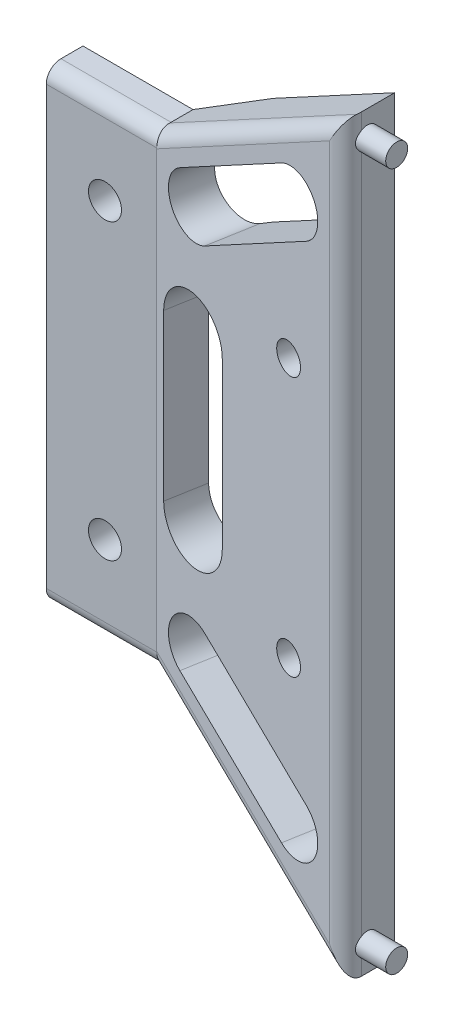
from build123d import *

# Parameters (mm, degrees)
BOSS_EXTRUDE1_DEPTH     = 12
CUT_EXTRUDE1_DEPTH      = 74.116345642
CUT_EXTRUDE1_DEPTH_BACK = 74.116345642
SKETCH4_R               = 1.5
BOSS_EXTRUDE2_DEPTH     = 4
SKETCH5_R               = 2.25
CUT_EXTRUDE2_DEPTH      = 76.204404791
FILLET1_R               = 2
CUT_EXTRUDE6_DEPTH      = 100.869521891
CUT_EXTRUDE6_DEPTH_BACK = 100.869521891
CUT_EXTRUDE7_DEPTH      = 10
CUT_EXTRUDE8_DEPTH      = 76.685850531
SKETCH12_R              = 2
CUT_EXTRUDE9_DEPTH      = 10


with BuildPart() as part:
    # Sketch1 → Boss-Extrude1 (new body)
    with BuildSketch(Plane.XY):
        Polygon((5, 31.75), (20, 31.75), (51, 51), (51, -51), (20, -31.75), (5, -31.75), align=None)
    extrude(amount=BOSS_EXTRUDE1_DEPTH)

    # Sketch3 → Cut-Extrude1 (cut, two sides: drawn at the far end of the back side and taken through both)
    with BuildSketch(Plane(origin=(0, 0, 0), x_dir=(1, 0, 0), z_dir=(0, 1, 0)).offset(-CUT_EXTRUDE1_DEPTH_BACK)):
        Polygon((5, -5), (20, -5), (51, -10.45), (51, -12), (5, -12), align=None)
    extrude(amount=CUT_EXTRUDE1_DEPTH + CUT_EXTRUDE1_DEPTH_BACK, mode=Mode.SUBTRACT)

    # Sketch4 → Boss-Extrude2 (add)
    with BuildSketch(Plane(origin=(51, 0, 0), x_dir=(0, 0, -1), z_dir=(1, 0, 0))):
        with Locations(Location((-7.25, 47.55, 0), (0, 0, 180))):
            Circle(SKETCH4_R)
        with Locations(Location((-7.25, -47.55, 0), (0, 0, 180))):
            Circle(SKETCH4_R)
    extrude(amount=BOSS_EXTRUDE2_DEPTH)

    # Sketch5 → Cut-Extrude2 (cut, through all)
    with BuildSketch(Plane.XY.offset(5)):
        with Locations((13, 20)):
            Circle(SKETCH5_R)
        with Locations((13, -20)):
            Circle(SKETCH5_R)
    extrude(amount=-CUT_EXTRUDE2_DEPTH, mode=Mode.SUBTRACT)

    # Fillet1
    # the kernel refuses this fillet: 2 mm, written as the material it takes off along each edge
    with BuildSketch(Plane(origin=(25, 31.75, 5), x_dir=(0, 0, -1), z_dir=(-1, 0, 0))) as fillet1_piece_1_section:
        with BuildLine():
            CenterArc((FILLET1_R, FILLET1_R), FILLET1_R, 180, 90)
            Line((0, FILLET1_R), (0, 0))
            Line((0, 0), (FILLET1_R, 0))
        make_face()
    fillet1_piece_1 = extrude(amount=25, mode=Mode.PRIVATE)
    fillet1_piece_1 = split(fillet1_piece_1, bisect_by=Plane(origin=(18.715742413, 30.952517466, 4.969963475), z_dir=(0.5275333931354667, -0.8495342954389665, 0)), keep=Keep.TOP, mode=Mode.PRIVATE)
    fillet1_piece_1 = split(fillet1_piece_1, bisect_by=Plane(origin=(18.98425176, 30.56216658, 4.821424906), z_dir=(-0.17315094766757883, 0, 0.9848952986596187)), keep=Keep.TOP, mode=Mode.PRIVATE)
    add(fillet1_piece_1, mode=Mode.SUBTRACT)
    with BuildSketch(Plane(origin=(25, 31.75, 5), x_dir=(0, 0, -1), z_dir=(-1, 0, 0))) as fillet1_piece_2_section:
        with BuildLine():
            CenterArc((FILLET1_R, FILLET1_R), FILLET1_R, 180, 90)
            Line((0, FILLET1_R), (0, 0))
            Line((0, 0), (FILLET1_R, 0))
        make_face()
    fillet1_piece_2 = extrude(amount=25, mode=Mode.PRIVATE)
    fillet1_piece_2 = split(fillet1_piece_2, bisect_by=Plane(origin=(17.89893605, 30.445307063, 4.049330952), z_dir=(-0.5275333931354667, 0.8495342954389665, 0)), keep=Keep.TOP, mode=Mode.PRIVATE)
    fillet1_piece_2 = split(fillet1_piece_2, bisect_by=Plane(origin=(17.101561994, 31.604505702, 4.490435899), z_dir=(0.17315094766757883, 0, -0.9848952986596187)), keep=Keep.TOP, mode=Mode.PRIVATE)
    add(fillet1_piece_2, mode=Mode.SUBTRACT)
    with BuildSketch(Plane(origin=(25, 31.75, 5), x_dir=(0, 0, -1), z_dir=(-1, 0, 0))) as fillet1_piece_3_section:
        with BuildLine():
            CenterArc((FILLET1_R, FILLET1_R), FILLET1_R, 180, 90)
            Line((0, FILLET1_R), (0, 0))
            Line((0, 0), (FILLET1_R, 0))
        make_face()
    fillet1_piece_3 = extrude(amount=25, mode=Mode.PRIVATE)
    fillet1_piece_3 = split(fillet1_piece_3, bisect_by=Plane(origin=(11.619741212, 26.546129624, 4.600643736), z_dir=(-0.5275333931354667, 0.8495342954389665, 0)), keep=Keep.TOP, mode=Mode.PRIVATE)
    fillet1_piece_3 = split(fillet1_piece_3, bisect_by=Plane(origin=(8.954230644, 31.275365282, 3.058082484), z_dir=(-0.17315094766757883, 0, 0.9848952986596187)), keep=Keep.TOP, mode=Mode.PRIVATE)
    add(fillet1_piece_3, mode=Mode.SUBTRACT)
    with BuildSketch(Plane(origin=(54.833361303, 53.380393713, 11.123929648), x_dir=(0.12548912150255187, 0.07792469641690664, -0.9890299399274274), z_dir=(-0.8402148531842905, -0.5217463201224826, -0.14771519193078717))) as fillet1_piece_4_section:
        with BuildLine():
            CenterArc((FILLET1_R * 0.9124716824, FILLET1_R), FILLET1_R, 185.240868247, 84.759131753)
            Line((-FILLET1_R * 0.0833478159779, FILLET1_R * 0.908657093052), (0, 0))
            Line((0, 0), (FILLET1_R * 0.9124716824, 0))
        make_face()
    fillet1_piece_4 = extrude(amount=46.020041731, mode=Mode.PRIVATE)
    fillet1_piece_4 = split(fillet1_piece_4, bisect_by=Plane(origin=(38.858531896, 31.75, 7.92634129), z_dir=(0, 1, 0)), keep=Keep.TOP, mode=Mode.PRIVATE)
    fillet1_piece_4 = split(fillet1_piece_4, bisect_by=Plane(origin=(38.858531896, 42.968514932, 5), z_dir=(0, 0, 1)), keep=Keep.TOP, mode=Mode.PRIVATE)
    add(fillet1_piece_4, mode=Mode.SUBTRACT)
    with BuildSketch(Plane(origin=(54.833361303, 53.380393713, 11.123929648), x_dir=(0.12548912150255187, 0.07792469641690664, -0.9890299399274274), z_dir=(-0.8402148531842905, -0.5217463201224826, -0.14771519193078717))) as fillet1_piece_5_section:
        with BuildLine():
            CenterArc((FILLET1_R * 0.9124716824, FILLET1_R), FILLET1_R, 185.240868247, 84.759131753)
            Line((-FILLET1_R * 0.0833478159779, FILLET1_R * 0.908657093052), (0, 0))
            Line((0, 0), (FILLET1_R * 0.9124716824, 0))
        make_face()
    fillet1_piece_5 = extrude(amount=46.020041731, mode=Mode.PRIVATE)
    fillet1_piece_5 = split(fillet1_piece_5, bisect_by=Plane(origin=(21.093126752, 31.75, 5.163454889), z_dir=(0, -1, 0)), keep=Keep.TOP, mode=Mode.PRIVATE)
    fillet1_piece_5 = split(fillet1_piece_5, bisect_by=Plane(origin=(21.093126752, 31.172659336, 5), z_dir=(0, 0, 1)), keep=Keep.TOP, mode=Mode.PRIVATE)
    add(fillet1_piece_5, mode=Mode.SUBTRACT)
    with BuildSketch(Plane(origin=(54.833361303, 53.380393713, 11.123929648), x_dir=(0.12548912150255187, 0.07792469641690664, -0.9890299399274274), z_dir=(-0.8402148531842905, -0.5217463201224826, -0.14771519193078717))) as fillet1_piece_6_section:
        with BuildLine():
            CenterArc((FILLET1_R * 0.9124716824, FILLET1_R), FILLET1_R, 185.240868247, 84.759131753)
            Line((-FILLET1_R * 0.0833478159779, FILLET1_R * 0.908657093052), (0, 0))
            Line((0, 0), (FILLET1_R * 0.9124716824, 0))
        make_face()
    fillet1_piece_6 = extrude(amount=46.020041731, mode=Mode.PRIVATE)
    fillet1_piece_6 = split(fillet1_piece_6, bisect_by=Plane(origin=(22.647114754, 31.75, 4.574160992), z_dir=(0, 1, 0)), keep=Keep.TOP, mode=Mode.PRIVATE)
    fillet1_piece_6 = split(fillet1_piece_6, bisect_by=Plane(origin=(22.647114754, 33.254110258, 5), z_dir=(0, 0, -1)), keep=Keep.TOP, mode=Mode.PRIVATE)
    add(fillet1_piece_6, mode=Mode.SUBTRACT)
    with BuildSketch(Plane(origin=(16.166638697, -29.369606287, 4.326070352), x_dir=(0.12548912150255273, -0.07792469641690525, -0.9890299399274274), z_dir=(0.8402148531842905, -0.5217463201224826, 0.14771519193078717))) as fillet1_piece_7_section:
        with BuildLine():
            CenterArc((FILLET1_R * 0.9124716824, FILLET1_R), FILLET1_R, 185.240868247, 84.759131753)
            Line((-FILLET1_R * 0.0833478159779, FILLET1_R * 0.908657093052), (0, 0))
            Line((0, 0), (FILLET1_R * 0.9124716824, 0))
        make_face()
    fillet1_piece_7 = extrude(amount=46.020041731, mode=Mode.PRIVATE)
    fillet1_piece_7 = split(fillet1_piece_7, bisect_by=Plane(origin=(21.093126752, -31.172659336, 5), z_dir=(0, 0, 1)), keep=Keep.TOP, mode=Mode.PRIVATE)
    fillet1_piece_7 = split(fillet1_piece_7, bisect_by=Plane(origin=(21.093126752, -31.75, 5.163454889), z_dir=(0, 1, 0)), keep=Keep.TOP, mode=Mode.PRIVATE)
    add(fillet1_piece_7, mode=Mode.SUBTRACT)
    with BuildSketch(Plane(origin=(16.166638697, -29.369606287, 4.326070352), x_dir=(0.12548912150255273, -0.07792469641690525, -0.9890299399274274), z_dir=(0.8402148531842905, -0.5217463201224826, 0.14771519193078717))) as fillet1_piece_8_section:
        with BuildLine():
            CenterArc((FILLET1_R * 0.9124716824, FILLET1_R), FILLET1_R, 185.240868247, 84.759131753)
            Line((-FILLET1_R * 0.0833478159779, FILLET1_R * 0.908657093052), (0, 0))
            Line((0, 0), (FILLET1_R * 0.9124716824, 0))
        make_face()
    fillet1_piece_8 = extrude(amount=46.020041731, mode=Mode.PRIVATE)
    fillet1_piece_8 = split(fillet1_piece_8, bisect_by=Plane(origin=(22.647114754, -33.254110258, 5), z_dir=(0, 0, -1)), keep=Keep.TOP, mode=Mode.PRIVATE)
    fillet1_piece_8 = split(fillet1_piece_8, bisect_by=Plane(origin=(22.647114754, -31.75, 4.574160992), z_dir=(0, -1, 0)), keep=Keep.TOP, mode=Mode.PRIVATE)
    add(fillet1_piece_8, mode=Mode.SUBTRACT)
    with BuildSketch(Plane(origin=(16.166638697, -29.369606287, 4.326070352), x_dir=(0.12548912150255273, -0.07792469641690525, -0.9890299399274274), z_dir=(0.8402148531842905, -0.5217463201224826, 0.14771519193078717))) as fillet1_piece_9_section:
        with BuildLine():
            CenterArc((FILLET1_R * 0.9124716824, FILLET1_R), FILLET1_R, 185.240868247, 84.759131753)
            Line((-FILLET1_R * 0.0833478159779, FILLET1_R * 0.908657093052), (0, 0))
            Line((0, 0), (FILLET1_R * 0.9124716824, 0))
        make_face()
    fillet1_piece_9 = extrude(amount=46.020041731, mode=Mode.PRIVATE)
    fillet1_piece_9 = split(fillet1_piece_9, bisect_by=Plane(origin=(38.858531896, -42.968514932, 5), z_dir=(0, 0, 1)), keep=Keep.TOP, mode=Mode.PRIVATE)
    fillet1_piece_9 = split(fillet1_piece_9, bisect_by=Plane(origin=(38.858531896, -31.75, 7.92634129), z_dir=(0, -1, 0)), keep=Keep.TOP, mode=Mode.PRIVATE)
    add(fillet1_piece_9, mode=Mode.SUBTRACT)
    with BuildSketch(Plane(origin=(0, -31.75, 5), x_dir=(0, 1, 0), z_dir=(1, 0, 0))) as fillet1_piece_10_section:
        with BuildLine():
            CenterArc((FILLET1_R, -FILLET1_R), FILLET1_R, 90, 90)
            Line((0, -FILLET1_R), (0, 0))
            Line((0, 0), (FILLET1_R, 0))
        make_face()
    fillet1_piece_10 = extrude(amount=25, mode=Mode.PRIVATE)
    fillet1_piece_10 = split(fillet1_piece_10, bisect_by=Plane(origin=(8.954230648, -31.275365282, 3.058082485), z_dir=(-0.17315094766757883, 0, 0.9848952986596187)), keep=Keep.TOP, mode=Mode.PRIVATE)
    fillet1_piece_10 = split(fillet1_piece_10, bisect_by=Plane(origin=(11.619741215, -26.546129625, 4.600643736), z_dir=(-0.5275333931354667, -0.8495342954389665, 0)), keep=Keep.TOP, mode=Mode.PRIVATE)
    add(fillet1_piece_10, mode=Mode.SUBTRACT)
    with BuildSketch(Plane(origin=(0, -31.75, 5), x_dir=(0, 1, 0), z_dir=(1, 0, 0))) as fillet1_piece_11_section:
        with BuildLine():
            CenterArc((FILLET1_R, -FILLET1_R), FILLET1_R, 90, 90)
            Line((0, -FILLET1_R), (0, 0))
            Line((0, 0), (FILLET1_R, 0))
        make_face()
    fillet1_piece_11 = extrude(amount=25, mode=Mode.PRIVATE)
    fillet1_piece_11 = split(fillet1_piece_11, bisect_by=Plane(origin=(17.101561993, -31.604505702, 4.490435899), z_dir=(0.17315094766757883, 0, -0.9848952986596187)), keep=Keep.TOP, mode=Mode.PRIVATE)
    fillet1_piece_11 = split(fillet1_piece_11, bisect_by=Plane(origin=(17.89893605, -30.445307063, 4.049330952), z_dir=(-0.5275333931354667, -0.8495342954389665, 0)), keep=Keep.TOP, mode=Mode.PRIVATE)
    add(fillet1_piece_11, mode=Mode.SUBTRACT)
    with BuildSketch(Plane(origin=(0, -31.75, 5), x_dir=(0, 1, 0), z_dir=(1, 0, 0))) as fillet1_piece_12_section:
        with BuildLine():
            CenterArc((FILLET1_R, -FILLET1_R), FILLET1_R, 90, 90)
            Line((0, -FILLET1_R), (0, 0))
            Line((0, 0), (FILLET1_R, 0))
        make_face()
    fillet1_piece_12 = extrude(amount=25, mode=Mode.PRIVATE)
    fillet1_piece_12 = split(fillet1_piece_12, bisect_by=Plane(origin=(18.984251758, -30.56216658, 4.821424906), z_dir=(-0.17315094766757883, 0, 0.9848952986596187)), keep=Keep.TOP, mode=Mode.PRIVATE)
    fillet1_piece_12 = split(fillet1_piece_12, bisect_by=Plane(origin=(18.715742412, -30.952517465, 4.969963474), z_dir=(0.5275333931354667, 0.8495342954389665, 0)), keep=Keep.TOP, mode=Mode.PRIVATE)
    add(fillet1_piece_12, mode=Mode.SUBTRACT)
    with BuildSketch(Plane(origin=(51, 56.95571402, 10.45), x_dir=(0, 0, -1), z_dir=(0, -1, 0))) as fillet1_piece_13_section:
        with BuildLine():
            CenterArc((FILLET1_R * 1.19114280398, -FILLET1_R), FILLET1_R, 90, 99.971072614)
            Line((FILLET1_R * 0.206247505316, -FILLET1_R * 1.17315094767), (0, 0))
            Line((0, 0), (FILLET1_R * 1.19114280398, 0))
        make_face()
    fillet1_piece_13 = extrude(amount=113.91142804, mode=Mode.PRIVATE)
    fillet1_piece_13 = fillet1_piece_13 - Plane(origin=(50.456443641, -47.55, 7.25), x_dir=(0, 0, 1), z_dir=(-1, 0, 0)) * Cylinder(1.5, 238, mode=Mode.PRIVATE)
    fillet1_piece_13 = fillet1_piece_13 - Plane(origin=(50.456443641, 47.55, 7.25), x_dir=(0, 0, 1), z_dir=(-1, 0, 0)) * Cylinder(1.5, 238, mode=Mode.PRIVATE)
    add(fillet1_piece_13, mode=Mode.SUBTRACT)
    with BuildSketch(Plane(origin=(51, 56, 0), x_dir=(-1, 0, 0), z_dir=(0, -1, 0))) as fillet1_piece_14:
        with BuildLine():
            CenterArc((FILLET1_R, -FILLET1_R), FILLET1_R, 90, 90)
            Line((0, -FILLET1_R), (0, 0))
            Line((0, 0), (FILLET1_R, 0))
        make_face()
    extrude(amount=112, mode=Mode.SUBTRACT)
    with BuildSketch(Plane(origin=(25, 31.75, 5), x_dir=(0, 0, -1), z_dir=(-1, 0, 0))) as fillet1_piece_15a_section:
        with BuildLine():
            CenterArc((FILLET1_R, FILLET1_R), FILLET1_R, 180, 90)
            Line((0, FILLET1_R), (0, 0))
            Line((0, 0), (FILLET1_R, 0))
        make_face()
    fillet1_piece_15a = extrude(amount=25, mode=Mode.PRIVATE)
    fillet1_piece_15a = split(fillet1_piece_15a, bisect_by=Plane(origin=(21.447626234, 32.648929194, 4.553184852), z_dir=(0.5275333931354667, -0.8495342954389665, 0)), keep=Keep.TOP, mode=Mode.PRIVATE)
    fillet1_piece_15a = split(fillet1_piece_15a, bisect_by=Plane(origin=(22.147583846, 31.288330463, 5.377559095), z_dir=(0.17315094766757883, 0, -0.9848952986596187)), keep=Keep.TOP, mode=Mode.PRIVATE)
    with BuildSketch(Plane(origin=(54.833361303, 53.380393713, 11.123929648), x_dir=(0.12548912150255187, 0.07792469641690664, -0.9890299399274274), z_dir=(-0.8402148531842905, -0.5217463201224826, -0.14771519193078717))) as fillet1_piece_15b_section:
        with BuildLine():
            CenterArc((FILLET1_R * 0.9124716824, FILLET1_R), FILLET1_R, 185.240868247, 84.759131753)
            Line((-FILLET1_R * 0.0833478159779, FILLET1_R * 0.908657093052), (0, 0))
            Line((0, 0), (FILLET1_R * 0.9124716824, 0))
        make_face()
    fillet1_piece_15b = extrude(amount=46.020041731, mode=Mode.PRIVATE)
    fillet1_piece_15b = split(fillet1_piece_15b, bisect_by=Plane(origin=(18.418601741, 31.75, 4.307776875), z_dir=(0, -1, 0)), keep=Keep.TOP, mode=Mode.PRIVATE)
    fillet1_piece_15b = split(fillet1_piece_15b, bisect_by=Plane(origin=(18.418601741, 30.298172554, 5), z_dir=(0, 0, -1)), keep=Keep.TOP, mode=Mode.PRIVATE)
    fillet1_piece_15 = fillet1_piece_15a & fillet1_piece_15b
    add(fillet1_piece_15, mode=Mode.SUBTRACT)
    with BuildSketch(Plane(origin=(0, -31.75, 5), x_dir=(0, 1, 0), z_dir=(1, 0, 0))) as fillet1_piece_16a_section:
        with BuildLine():
            CenterArc((FILLET1_R, -FILLET1_R), FILLET1_R, 90, 90)
            Line((0, -FILLET1_R), (0, 0))
            Line((0, 0), (FILLET1_R, 0))
        make_face()
    fillet1_piece_16a = extrude(amount=25, mode=Mode.PRIVATE)
    fillet1_piece_16a = split(fillet1_piece_16a, bisect_by=Plane(origin=(22.147583841, -31.288330462, 5.377559095), z_dir=(0.17315094766757883, 0, -0.9848952986596187)), keep=Keep.TOP, mode=Mode.PRIVATE)
    fillet1_piece_16a = split(fillet1_piece_16a, bisect_by=Plane(origin=(21.447626231, -32.648929192, 4.553184851), z_dir=(0.5275333931354667, 0.8495342954389665, 0)), keep=Keep.TOP, mode=Mode.PRIVATE)
    with BuildSketch(Plane(origin=(16.166638697, -29.369606287, 4.326070352), x_dir=(0.12548912150255273, -0.07792469641690525, -0.9890299399274274), z_dir=(0.8402148531842905, -0.5217463201224826, 0.14771519193078717))) as fillet1_piece_16b_section:
        with BuildLine():
            CenterArc((FILLET1_R * 0.9124716824, FILLET1_R), FILLET1_R, 185.240868247, 84.759131753)
            Line((-FILLET1_R * 0.0833478159779, FILLET1_R * 0.908657093052), (0, 0))
            Line((0, 0), (FILLET1_R * 0.9124716824, 0))
        make_face()
    fillet1_piece_16b = extrude(amount=46.020041731, mode=Mode.PRIVATE)
    fillet1_piece_16b = split(fillet1_piece_16b, bisect_by=Plane(origin=(18.418601741, -30.298172554, 5), z_dir=(0, 0, -1)), keep=Keep.TOP, mode=Mode.PRIVATE)
    fillet1_piece_16b = split(fillet1_piece_16b, bisect_by=Plane(origin=(18.418601741, -31.75, 4.307776875), z_dir=(0, 1, 0)), keep=Keep.TOP, mode=Mode.PRIVATE)
    fillet1_piece_16 = fillet1_piece_16a & fillet1_piece_16b
    add(fillet1_piece_16, mode=Mode.SUBTRACT)

    # Sketch9 → Cut-Extrude6 (cut, two sides: drawn at the far end of the back side and taken through both)
    with BuildSketch(Plane(origin=(0, -31.75, 0), x_dir=(-1, 0, 0), z_dir=(0, -1, 0)).offset(-CUT_EXTRUDE6_DEPTH_BACK)):
        Polygon((-51, -3.528133081), (-30.931720088, 0), (-51, 0), align=None)
    extrude(amount=CUT_EXTRUDE6_DEPTH + CUT_EXTRUDE6_DEPTH_BACK, mode=Mode.SUBTRACT)

    # Sketch10 → Cut-Extrude7 (cut)
    with BuildSketch(Plane(origin=(-0.253052758, 0, 1.43938266), x_dir=(0.9848952986596188, 0, 0.17315094766757885), z_dir=(-0.17315094766757885, 0, 0.9848952986596188))):
        with BuildLine():
            Line((45.743787307, 33.288733998), (28.681773623, 22.853807596))
            ThreePointArc((28.681773623, 22.853807596), (23.182385605, 24.179225052), (24.507803062, 29.67861307))
            Line((24.507803062, 29.67861307), (41.569816746, 40.113539472))
            ThreePointArc((41.569816746, 40.113539472), (47.069204764, 38.788122016), (45.743787307, 33.288733998))
        make_face()
    cut_extrude7 = extrude(amount=-CUT_EXTRUDE7_DEPTH, mode=Mode.SUBTRACT)

    # Mirror2: Cut-Extrude7 across plane
    add(cut_extrude7.mirror(Plane.ZX), mode=Mode.SUBTRACT)

    # Sketch11 → Cut-Extrude8 (cut, through all)
    with BuildSketch(Plane(origin=(-0.253052758, 0, 1.43938266), x_dir=(0.9848952986596188, 0, 0.17315094766757885), z_dir=(-0.17315094766757885, 0, 0.9848952986596188))):
        with BuildLine():
            Line((31.626592624, 11.254011747), (31.626592624, -11.254011747))
            ThreePointArc((31.626592624, -11.254011747), (26.708411928, -16.172192443), (21.790231232, -11.254011747))
            Line((21.790231232, -11.254011747), (21.790231232, 11.254011747))
            ThreePointArc((21.790231232, 11.254011747), (26.708411928, 16.172192443), (31.626592624, 11.254011747))
        make_face()
    extrude(amount=-CUT_EXTRUDE8_DEPTH, mode=Mode.SUBTRACT)

    # Sketch12 → Cut-Extrude9 (cut)
    with BuildSketch(Plane(origin=(-0.253052758, 0, 1.43938266), x_dir=(0.9848952986596187, 0, 0.17315094766757885), z_dir=(-0.17315094766757885, 0, 0.9848952986596188))):
        with Locations((42.764756369, 17.78484358)):
            Circle(SKETCH12_R)
        with Locations((42.764756369, -17.598635798)):
            Circle(SKETCH12_R)
    extrude(amount=-CUT_EXTRUDE9_DEPTH, mode=Mode.SUBTRACT)


solid = part.part
